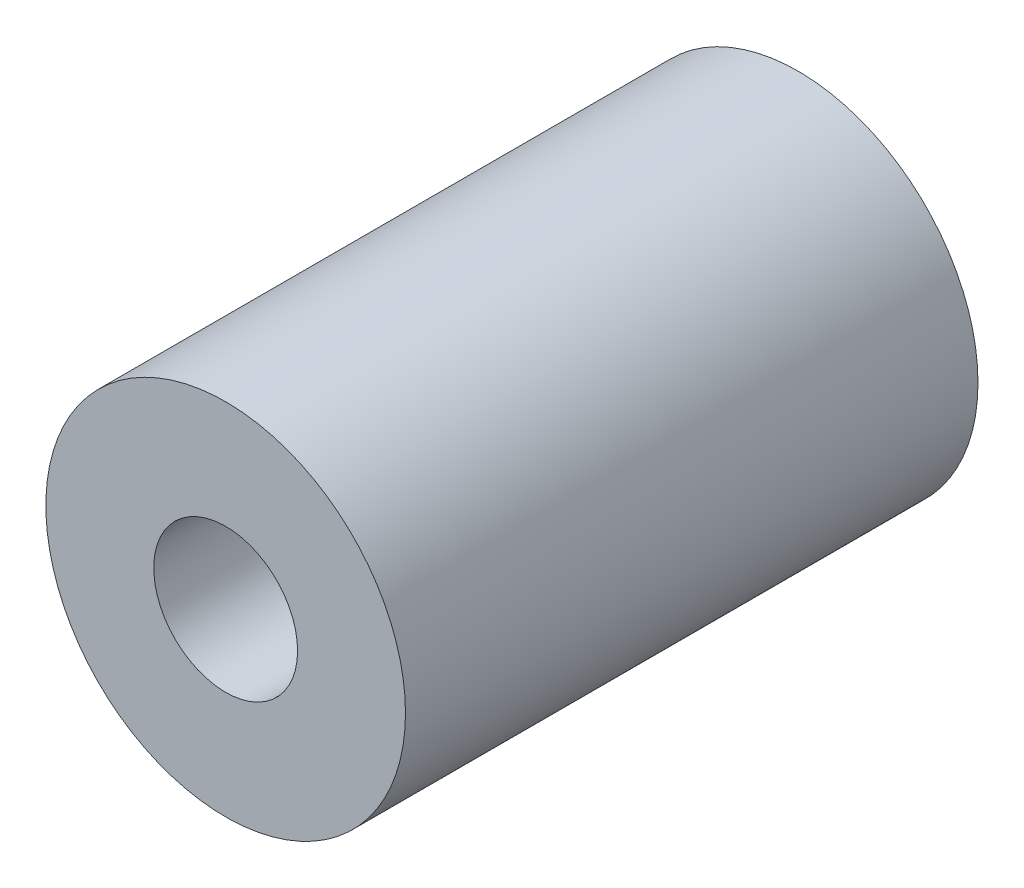
from build123d import *

# Parameters (mm, degrees)
SKETCH1_R           = 3.175
SKETCH1_R_2         = 1.27
BOSS_EXTRUDE1_DEPTH = 10.1092


with BuildPart() as part:
    # Sketch1 → Boss-Extrude1 (new body)
    with BuildSketch(Plane.XY):
        Circle(SKETCH1_R)
        Circle(SKETCH1_R_2, mode=Mode.SUBTRACT)
    extrude(amount=BOSS_EXTRUDE1_DEPTH)


solid = part.part
